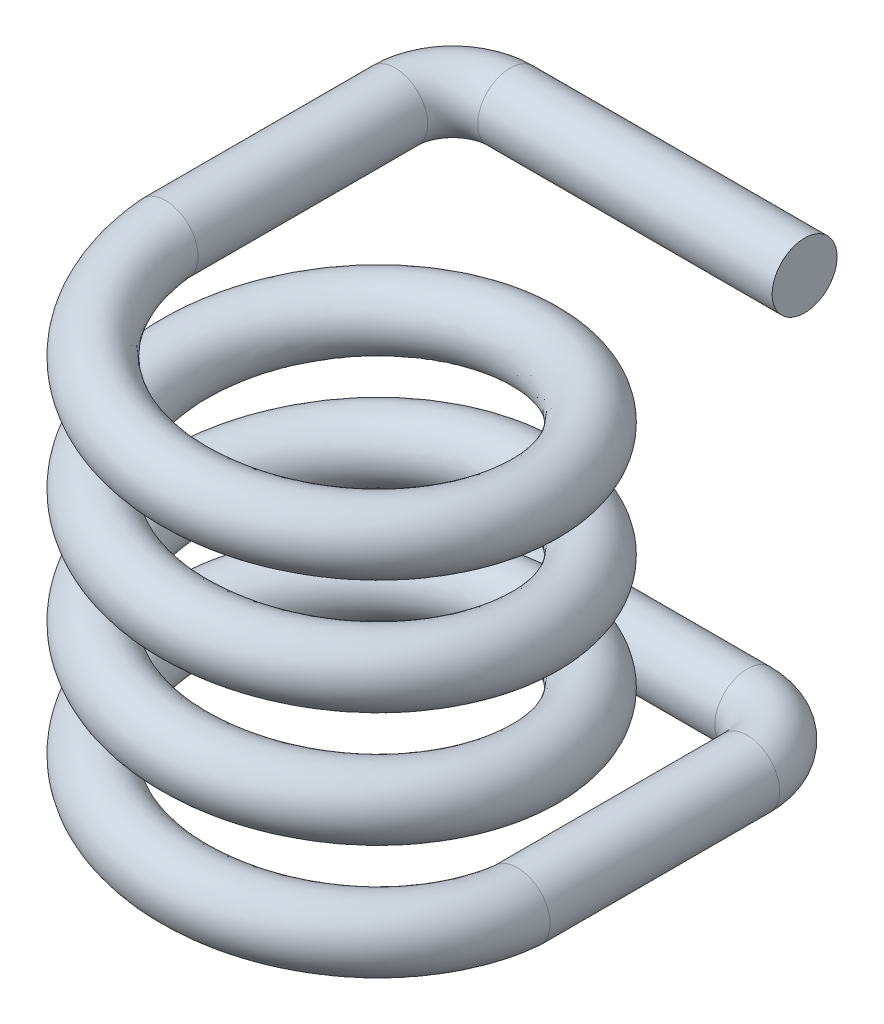
from build123d import *

# Parameters (mm, degrees)
SWEEP1_PITCH       = 4
SWEEP1_HEIGHT      = 14
SWEEP1_RADIUS      = 6.13
SWEEP1_START_ANGLE = 90
SKETCH1_R          = 1.13
SKETCH1_3_R        = 1.13
SWEEP3_OUTLINE_R   = 1.13
SWEEP3_ANGLE       = 90
SWEEP3_START       = -8.0000001
SWEEP3_2_OUTLINE_R = 1.13
SWEEP3_2_DEPTH     = 8.0000001
SWEEP3_START_2     = -4.1300001
SWEEP3_3_OUTLINE_R = 1.13
SWEEP3_3_DEPTH     = 10.2600001


with BuildPart() as part:
    # Sweep1: sweep along a helix
    with BuildLine() as sweep1_path:
        add(Helix(SWEEP1_PITCH, SWEEP1_HEIGHT, SWEEP1_RADIUS, center=(0, 0, 0), direction=(0, 1, 0), lefthand=True, mode=Mode.PRIVATE).rotate(Axis((0, 0, 0), (0, 1, 0)), SWEEP1_START_ANGLE))
    # Sketch1 → Sweep1 (sweep)
    with BuildSketch(Plane.XY):
        with Locations((6.13, 0)):
            Circle(SKETCH1_R)
    sweep(path=sweep1_path.line, is_frenet=True)

    # Sweep2: sweep along a path in Sketch3
    with BuildLine(Plane(origin=(0, 0, 0), x_dir=(1, 0, 0), z_dir=(0, 1, 0))) as sweep2_path:
        Line((6.13, 0), (6.13, 8))
        ThreePointArc((6.13, 8), (5.544213562, 9.414213562), (4.13, 10))
        Line((4.13, 10), (-6.13, 10))
    # Sketch1<3> → Sweep2 (sweep)
    with BuildSketch(Plane.XY):
        with Locations((6.13, 0)):
            Circle(SKETCH1_3_R)
    sweep(path=sweep2_path.line)



with BuildPart() as body_2:
    # Sweep3: read off the stored shape, not the designer's step
    # Sweep3 outline → Sweep3 (revolve)
    with BuildSketch(Plane(origin=(-4.13, 0, -8), x_dir=(0, 0, -1), z_dir=(1, 0, 0))):
        with Locations((2, 14)):
            Circle(SWEEP3_OUTLINE_R)
    revolve(axis=Axis((-4.13, 0, -8), (0, 1, 0)), revolution_arc=SWEEP3_ANGLE)


with BuildPart() as part_1:
    add(part.part)

    add(body_2.part)  # Sweep3 2 merges body 2
    # Sweep3 2 outline → Sweep3 2 (add)
    with BuildSketch(Plane.XY.offset(SWEEP3_START)):
        with Locations((-6.13, 14)):
            Circle(SWEEP3_2_OUTLINE_R)
    extrude(amount=SWEEP3_2_DEPTH)

    # Sweep3 3 outline → Sweep3 3 (add)
    with BuildSketch(Plane.YZ.offset(SWEEP3_START_2)):
        with Locations((14, -10)):
            Circle(SWEEP3_3_OUTLINE_R)
    extrude(amount=SWEEP3_3_DEPTH)


solid = part_1.part
